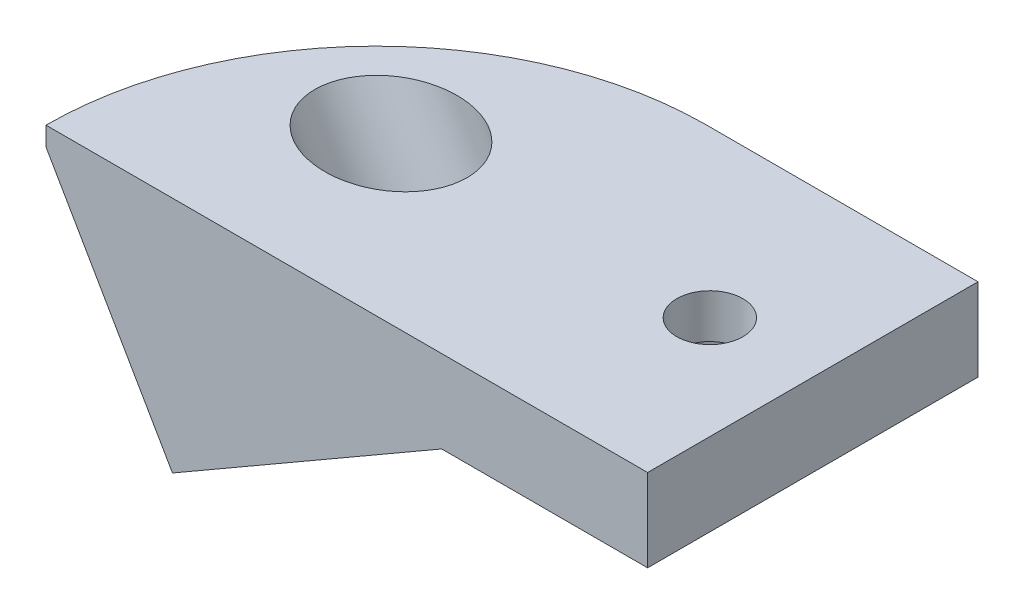
from build123d import *

# Parameters (mm, degrees)
ESBO_O1_W                = 30
ESBO_O1_H                = 30
RESSALTO_EXTRUS_O1_DEPTH = 22.775
CORTE_EXTRUS_O1_DEPTH    = 41.542577927
ESBO_O3_OUTSIDE_W        = 48.998
ESBO_O3_OUTSIDE_H        = 41.63
ESBO_O3_OUTSIDE_W_2      = 30
ESBO_O3_OUTSIDE_H_2      = 30
CORTE_EXTRUS_O2_DEPTH    = 30.010251575
RESSALTO_EXTRUS_O2_DEPTH = 30
ESBO_O5_R                = 3.95
CORTE_EXTRUS_O3_DEPTH    = 32.012511133
CORTE_EXTRUS_O5_START    = -8
ESBO_O8_R                = 6
CORTE_EXTRUS_O5_DEPTH    = 25
RESSALTO_EXTRUS_O6_DEPTH = 30
CORTE_EXTRUS_O11_START   = -21.614745962
CORTE_EXTRUS_O11_DEPTH   = 21.614745962
ESBO_O19_R               = 6.35
CORTE_EXTRUS_O12_DEPTH   = 3.5
ESBO_O20_R               = 3
CORTE_EXTRUS_O13_DEPTH   = 26


with BuildPart() as part:
    # Esboço1 → Ressalto-extrusão1 (new body)
    with BuildSketch(Plane(origin=(0, 0, 0), x_dir=(1, 0, 0), z_dir=(0, 1, 0))):
        Rectangle(ESBO_O1_W, ESBO_O1_H)
    extrude(amount=RESSALTO_EXTRUS_O1_DEPTH)

    # Esboço2 → Corte-extrusão1 (cut, through all)
    with BuildSketch(Plane.XY.offset(15)):
        Polygon((-15, 0), (15, 17.320508076), (15, 0), align=None)
    extrude(amount=-CORTE_EXTRUS_O1_DEPTH, mode=Mode.SUBTRACT)

    # Esboço3 outside → Corte-extrusão2 (cut, through all)
    with BuildSketch(Plane(origin=(-3.75, 6.495190528, 0), x_dir=(0.8660254037844378, 0.5000000000000017, 0), z_dir=(0.5000000000000016, -0.8660254037844377, 0))):
        with Locations((5.694, 0)):
            Rectangle(ESBO_O3_OUTSIDE_W, ESBO_O3_OUTSIDE_H)
        with Locations((4.330127019, 0)):
            Rectangle(ESBO_O3_OUTSIDE_W_2, ESBO_O3_OUTSIDE_H_2, mode=Mode.SUBTRACT)
    extrude(amount=-CORTE_EXTRUS_O2_DEPTH, mode=Mode.SUBTRACT)

    # Esboço4 → Ressalto-extrusão2 (add)
    with BuildSketch(Plane.XY.offset(15)):
        Polygon((-25.469660456, 22.775), (-15, 4.641016151), (-15, 22.775), align=None)
    extrude(amount=-RESSALTO_EXTRUS_O2_DEPTH)

    # Esboço5 → Corte-extrusão3 (cut, through all)
    with BuildSketch(Plane(origin=(-3.75, 6.495190528, 0), x_dir=(-0.8660254037844379, -0.5000000000000013, 0), z_dir=(0.5000000000000013, -0.8660254037844379, 0))):
        with Locations(Location((-4.330131096, -4.077e-06, 0), (0, 0, 180))):
            Circle(ESBO_O5_R)
    extrude(amount=-CORTE_EXTRUS_O3_DEPTH, mode=Mode.SUBTRACT)

    # Esboço8 → Corte-extrusão5 (cut)
    with BuildSketch(Plane(origin=(-3.75, 6.495190528, 0), x_dir=(0.8660254037844379, 0.5000000000000013, 0), z_dir=(0.5000000000000013, -0.8660254037844379, 0)).offset(CORTE_EXTRUS_O5_START)):
        with Locations((4.330131096, 4.077e-06)):
            Circle(ESBO_O8_R)
    extrude(amount=-CORTE_EXTRUS_O5_DEPTH, mode=Mode.SUBTRACT)

    # Esboço16 → Ressalto-extrusão6 (add)
    with BuildSketch(Plane.XY.offset(15)):
        Polygon((9.171355695, 22.775), (30.157076086, 22.775), (30.157076086, 15.275), (11.457076086, 15.275), align=None)
    extrude(amount=-RESSALTO_EXTRUS_O6_DEPTH)

    # Corte-extrusão11: read off the stored shape, not the designer's step
    # Corte-extrusão11 outline → Corte-extrusão11 (cut)
    with BuildSketch(Plane(origin=(0, 22.775, 0), x_dir=(1, 0, 0), z_dir=(0, 1, 0)).offset(CORTE_EXTRUS_O11_START)):
        with BuildLine():
            ThreePointArc((-24.474983506, -14.999998017), (-15.795064462, 6.105795279), (5.221968287, 14.998479898))
            Line((5.221968287, 14.998479898), (5.221968287, 15))
            Line((5.221968287, 15), (-26, 15))
            Line((-26, 15), (-26, -16))
            Line((-26, -16), (-24.47498322, -16))
            Line((-24.47498322, -16), (-24.474983506, -14.999998017))
        make_face()
    extrude(amount=CORTE_EXTRUS_O11_DEPTH, mode=Mode.SUBTRACT)

    # Esboço19 → Corte-extrusão12 (cut)
    with BuildSketch(Plane.XZ.offset(-15.275)):
        with Locations((20.807076086, 0)):
            Circle(ESBO_O19_R)
    extrude(amount=-CORTE_EXTRUS_O12_DEPTH, mode=Mode.SUBTRACT)

    # Esboço20 → Corte-extrusão13 (cut)
    with BuildSketch(Plane.XZ.offset(-18.775)):
        with Locations((20.807076086, 0)):
            Circle(ESBO_O20_R)
    extrude(amount=-CORTE_EXTRUS_O13_DEPTH, mode=Mode.SUBTRACT)


solid = part.part
